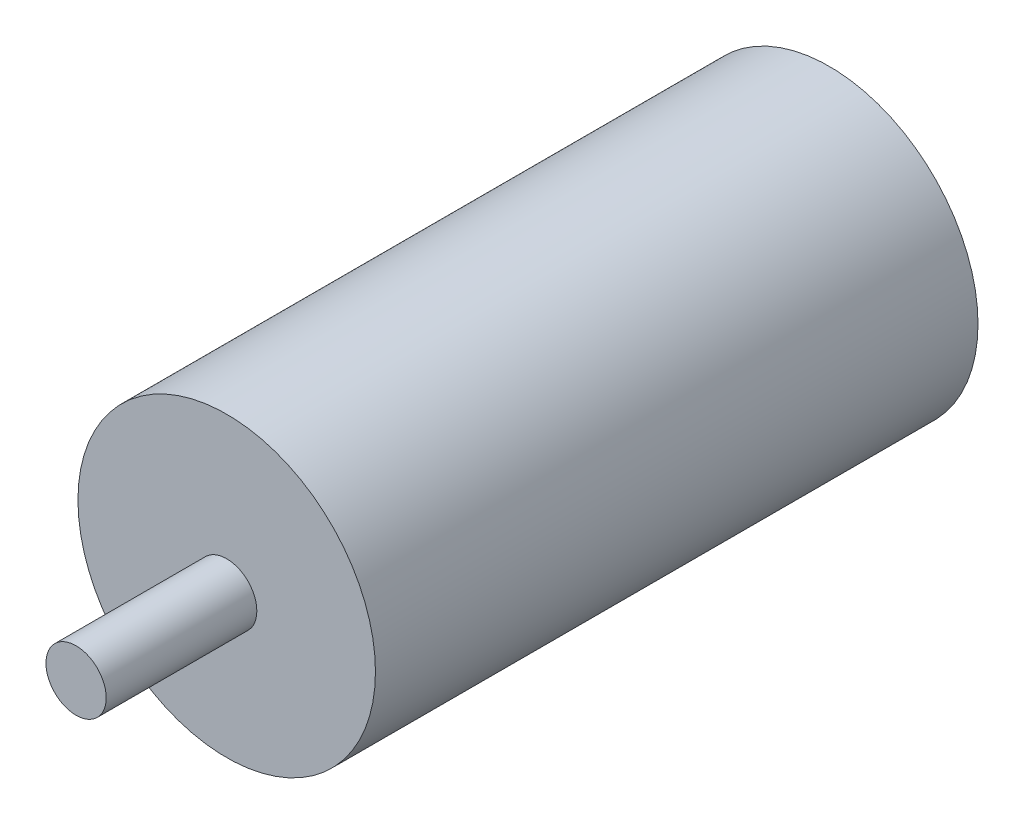
from build123d import *

# Parameters (mm, degrees)
SKETCH1_R           = 19.75
BOSS_EXTRUDE1_DEPTH = 80
SKETCH2_R           = 4
BOSS_EXTRUDE2_DEPTH = 20


with BuildPart() as part:
    # Sketch1 → Boss-Extrude1 (new body)
    with BuildSketch(Plane.XY):
        Circle(SKETCH1_R)
    extrude(amount=BOSS_EXTRUDE1_DEPTH)

    # Sketch2 → Boss-Extrude2 (add)
    with BuildSketch(Plane.XY.offset(80)):
        with Locations((0, -0.874256131)):
            Circle(SKETCH2_R)
    extrude(amount=BOSS_EXTRUDE2_DEPTH)


solid = part.part
